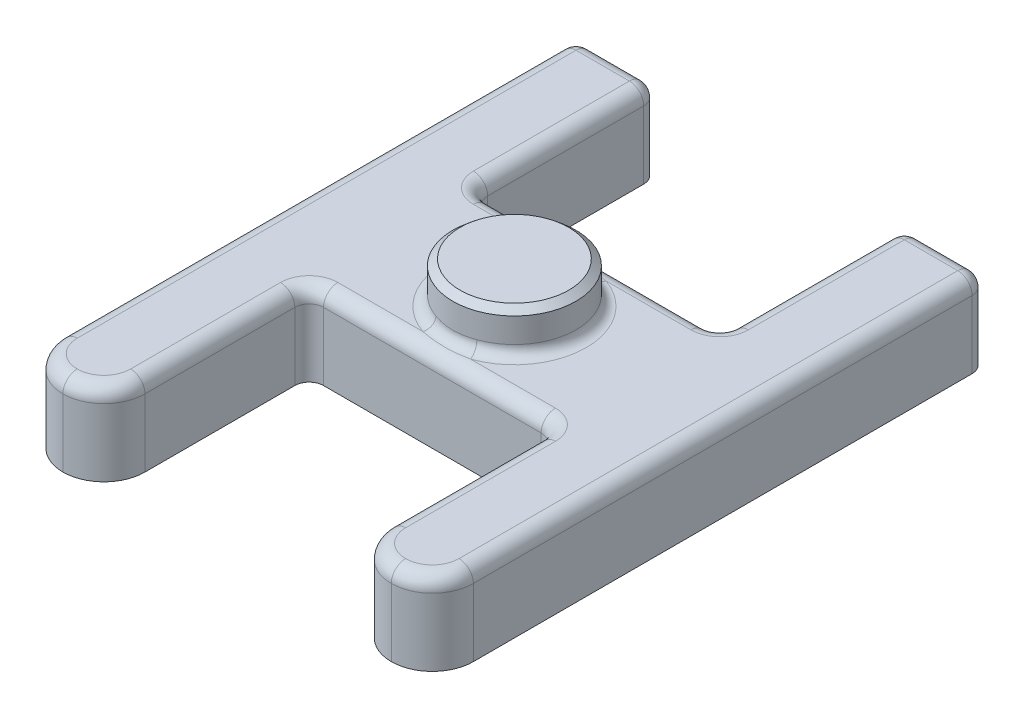
from build123d import *

# Parameters (mm, degrees)
SKETCH2_W               = 508
SKETCH2_H               = 101.6
BOSS_EXTRUDE2_DEPTH     = 965.2
SKETCH3_R               = 25.4
SKETCH3_W               = 25.4
SKETCH3_H               = 25.4
CUT_EXTRUDE1_DEPTH      = 50.8
CUT_EXTRUDE2_DEPTH      = 1096.444019565
CUT_EXTRUDE2_DEPTH_BACK = 1096.444019565
FILLET1_R               = 17.78
FILLET6_R               = 50.8
SKETCH5_R               = 76.2
BOSS_EXTRUDE3_DEPTH     = 50.8
FILLET2_R               = 12.7
CHAMFER1_SIZE           = 7.46
CHAMFER1_SIZE2          = 8.890481801


with BuildPart() as part:
    # Sketch2 → Boss-Extrude2 (new body)
    with BuildSketch(Plane.XY):
        with Locations((254, 50.8)):
            Rectangle(SKETCH2_W, SKETCH2_H)
    extrude(amount=BOSS_EXTRUDE2_DEPTH)

    # Sketch3 → Cut-Extrude1 (cut)
    with BuildSketch(Plane(origin=(0, 0, 0), x_dir=(-1, 0, 0), z_dir=(0, -1, 0))):
        with Locations(Location((-50.8, -762, 0), (0, 0, 90))):
            Circle(SKETCH3_R)
        with Locations(Location((-457.2, -762, 0), (0, 0, 90))):
            Circle(SKETCH3_R)
        with Locations((-457.2, -215.9)):
            Rectangle(SKETCH3_W, SKETCH3_H)
        with Locations((-50.8, -215.9)):
            Rectangle(SKETCH3_W, SKETCH3_H)
    extrude(amount=-CUT_EXTRUDE1_DEPTH, mode=Mode.SUBTRACT)

    # Sketch4 → Cut-Extrude2 (cut, two sides: drawn at the far end of the back side and taken through both)
    with BuildSketch(Plane.XZ.offset(-CUT_EXTRUDE2_DEPTH_BACK)):
        Polygon((101.6, 965.2), (406.4, 965.2), (508, 965.2), (508, 838.2), (406.4, 838.2), (406.4, 584.2), (101.6, 584.2), (101.6, 838.2), (0, 838.2), (0, 965.2), align=None)
        Polygon((101.6, 381), (406.4, 381), (406.4, 152.4), (508, 152.4), (508, 0), (406.4, 0), (101.6, 0), (0, 0), (0, 152.4), (101.6, 152.4), align=None)
    extrude(amount=CUT_EXTRUDE2_DEPTH + CUT_EXTRUDE2_DEPTH_BACK, mode=Mode.SUBTRACT)

    # Fillet1
    fillet1_edges = [part.edges().sort_by_distance(p)[0] for p in [
        (0, 101.6, 495.3),
        (508, 101.6, 495.3),
        (406.4, 101.6, 711.2),
        (406.4, 50.8, 584.2),
        (254, 101.6, 584.2),
        (101.6, 50.8, 584.2),
        (101.6, 101.6, 711.2),
        (457.2, 101.6, 838.2),
        (50.8, 101.6, 838.2),
        (101.6, 50.8, 152.4),
        (101.6, 101.6, 266.7),
        (101.6, 50.8, 381),
        (254, 101.6, 381),
        (406.4, 50.8, 381),
        (406.4, 101.6, 266.7),
        (406.4, 50.8, 152.4),
        (457.2, 101.6, 152.4),
        (0, 50.8, 152.4),
        (50.8, 101.6, 152.4),
        (508, 50.8, 152.4),
    ]]
    fillet(fillet1_edges, radius=FILLET1_R)

    # Fillet6
    # the kernel refuses this fillet: 50.8 mm, written as the material it takes off along each edge
    with BuildSketch(Plane(origin=(50.8, 101.6, 787.4), x_dir=(-1, 0, 0), z_dir=(0, 0, -1))) as fillet6_piece_1:
        with BuildLine():
            CenterArc((33.02, -17.78), 17.78, 0, 90)
            Line((50.8, -17.78), (50.8, 0))
            Line((50.8, 0), (33.02, 0))
        make_face()
    revolve(axis=Axis((50.8, 101.6, 787.4), (0, 1, 0)), revolution_arc=90, mode=Mode.SUBTRACT)
    with BuildSketch(Plane(origin=(50.8, 101.6, 787.4), x_dir=(0, 0, 1), z_dir=(-1, 0, 0))) as fillet6_piece_2:
        with BuildLine():
            CenterArc((33.02, -17.78), 17.78, 0, 90)
            Line((50.8, -17.78), (50.8, 0))
            Line((50.8, 0), (33.02, 0))
        make_face()
    revolve(axis=Axis((50.8, 101.6, 787.4), (0, 1, 0)), revolution_arc=90, mode=Mode.SUBTRACT)
    with BuildSketch(Plane(origin=(457.2, 101.6, 787.4), x_dir=(-1, 0, 0), z_dir=(0, 0, -1))) as fillet6_piece_3:
        with BuildLine():
            CenterArc((33.02, -17.78), 17.78, 0, 90)
            Line((50.8, -17.78), (50.8, 0))
            Line((50.8, 0), (33.02, 0))
        make_face()
    revolve(axis=Axis((457.2, 101.6, 787.4), (0, 1, 0)), revolution_arc=90, mode=Mode.SUBTRACT)
    with BuildSketch(Plane(origin=(457.2, 101.6, 787.4), x_dir=(0, 0, 1), z_dir=(-1, 0, 0))) as fillet6_piece_4:
        with BuildLine():
            CenterArc((33.02, -17.78), 17.78, 0, 90)
            Line((50.8, -17.78), (50.8, 0))
            Line((50.8, 0), (33.02, 0))
        make_face()
    revolve(axis=Axis((457.2, 101.6, 787.4), (0, 1, 0)), revolution_arc=90, mode=Mode.SUBTRACT)
    with BuildSketch(Plane(origin=(508, -127, 838.2), x_dir=(-1, 0, 0), z_dir=(0, 1, 0)), Plane(origin=(406.4, -127, 838.2), x_dir=(0, 0, -1), z_dir=(0, 1, 0))) as fillet6_piece_5:
        with BuildLine():
            CenterArc((FILLET6_R, -FILLET6_R), FILLET6_R, 90, 90)
            Line((0, -FILLET6_R), (0, 0))
            Line((0, 0), (FILLET6_R, 0))
        make_face()
    extrude(amount=228.6, mode=Mode.SUBTRACT)
    with BuildSketch(Plane(origin=(101.6, 101.6, 838.2), x_dir=(-1, 0, 0), z_dir=(0, -1, 0)), Plane(origin=(0, 101.6, 838.2), x_dir=(0, 0, -1), z_dir=(0, -1, 0))) as fillet6_piece_6:
        with BuildLine():
            CenterArc((FILLET6_R, FILLET6_R), FILLET6_R, 180, 90)
            Line((0, FILLET6_R), (0, 0))
            Line((0, 0), (FILLET6_R, 0))
        make_face()
    extrude(amount=228.6, mode=Mode.SUBTRACT)

    # Sketch5 → Boss-Extrude3 (add)
    with BuildSketch(Plane(origin=(0, 101.6, 0), x_dir=(1, 0, 0), z_dir=(0, 1, 0))):
        with Locations((254, -482.6)):
            Circle(SKETCH5_R)
    extrude(amount=BOSS_EXTRUDE3_DEPTH)

    # Fillet2
    fillet2_edges = [part.edges().sort_by_distance(p)[0] for p in [
        (177.8, 101.6, 482.6),
    ]]
    fillet(fillet2_edges, radius=FILLET2_R)

    # Chamfer1
    chamfer1_edges = [part.edges().sort_by_distance(p)[0] for p in [
        (177.8, 152.4, 482.6),
    ]]
    chamfer1_side = [part.faces().sort_by_distance(p)[0] for p in [
        (177.8, 133.057233691, 482.6),
    ]]
    chamfer(chamfer1_edges, length=CHAMFER1_SIZE, length2=CHAMFER1_SIZE2, reference=chamfer1_side[0])


solid = part.part
